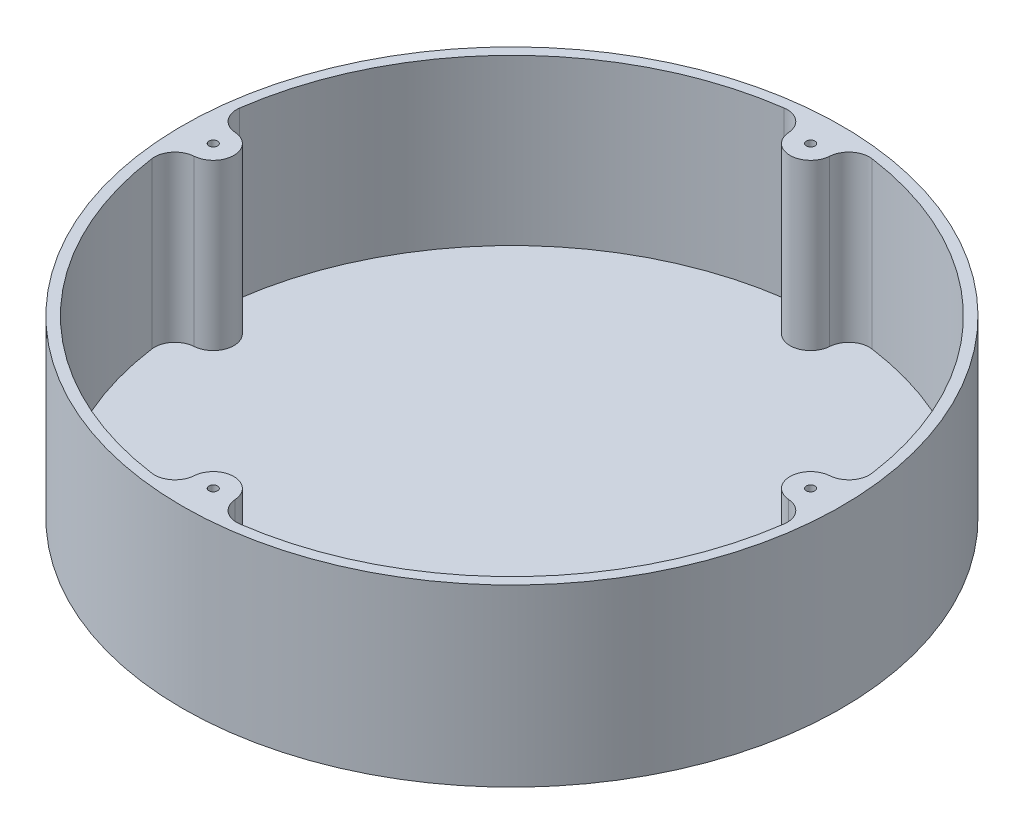
from build123d import *

# Parameters (mm, degrees)
SKETCH1_R           = 101.6
BOSS_EXTRUDE1_DEPTH = 53.975
SKETCH2_R           = 1.3208
CUT_EXTRUDE1_DEPTH  = 50.8
FILLET1_R           = 6.35


with BuildPart() as part:
    # Sketch1 → Boss-Extrude1 (new body)
    with BuildSketch(Plane(origin=(0, 0, 0), x_dir=(1, 0, 0), z_dir=(0, 1, 0))):
        Circle(SKETCH1_R)
    extrude(amount=BOSS_EXTRUDE1_DEPTH)

    # Sketch2 → Cut-Extrude1 (cut)
    with BuildSketch(Plane(origin=(0, 53.975, 0), x_dir=(1, 0, 0), z_dir=(0, 1, 0))):
        with Locations((0, 92.075)):
            Circle(SKETCH2_R)
        with Locations((92.075, 0)):
            Circle(SKETCH2_R)
        with Locations((0, -92.075)):
            Circle(SKETCH2_R)
        with Locations((-92.075, 0)):
            Circle(SKETCH2_R)
        with BuildLine():
            Line((-6.35, 92.075), (-6.35, 98.219947694))
            ThreePointArc((-6.35, 98.219947694), (-69.598155758, 69.595814099), (-98.22016129, 6.34669529))
            Line((-98.22016129, 6.34669529), (-91.87016129, 6.34669529))
            ThreePointArc((-91.87016129, 6.34669529), (-85.725826231, -0.102432683), (-92.075, -6.35))
            Line((-92.075, -6.35), (-98.219947694, -6.35))
            ThreePointArc((-98.219947694, -6.35), (-69.595814099, -69.598155758), (-6.34669529, -98.22016129))
            Line((-6.34669529, -98.22016129), (-6.34669529, -91.87016129))
            ThreePointArc((-6.34669529, -91.87016129), (0.102432683, -85.725826231), (6.35, -92.075))
            Line((6.35, -92.075), (6.35, -98.219947694))
            ThreePointArc((6.35, -98.219947694), (69.598155758, -69.595814099), (98.22016129, -6.34669529))
            Line((98.22016129, -6.34669529), (91.87016129, -6.34669529))
            ThreePointArc((91.87016129, -6.34669529), (85.725826231, 0.102432683), (92.075, 6.35))
            Line((92.075, 6.35), (98.219947694, 6.35))
            ThreePointArc((98.219947694, 6.35), (69.595814099, 69.598155758), (6.34669529, 98.22016129))
            Line((6.34669529, 98.22016129), (6.34669529, 91.87016129))
            ThreePointArc((6.34669529, 91.87016129), (-0.102432683, 85.725826231), (-6.35, 92.075))
        make_face()
    extrude(amount=-CUT_EXTRUDE1_DEPTH, mode=Mode.SUBTRACT)

    # Fillet1
    fillet1_edges = [part.edges().sort_by_distance(p)[0] for p in [
        (-98.219947694, 28.575, 6.35),
        (-98.22016129, 28.575, -6.34669529),
        (-6.35, 28.575, -98.219947694),
        (6.34669529, 28.575, -98.22016129),
        (98.219947694, 28.575, -6.35),
        (98.22016129, 28.575, 6.34669529),
        (-6.34669529, 28.575, 98.22016129),
        (6.35, 28.575, 98.219947694),
    ]]
    fillet(fillet1_edges, radius=FILLET1_R)


solid = part.part
